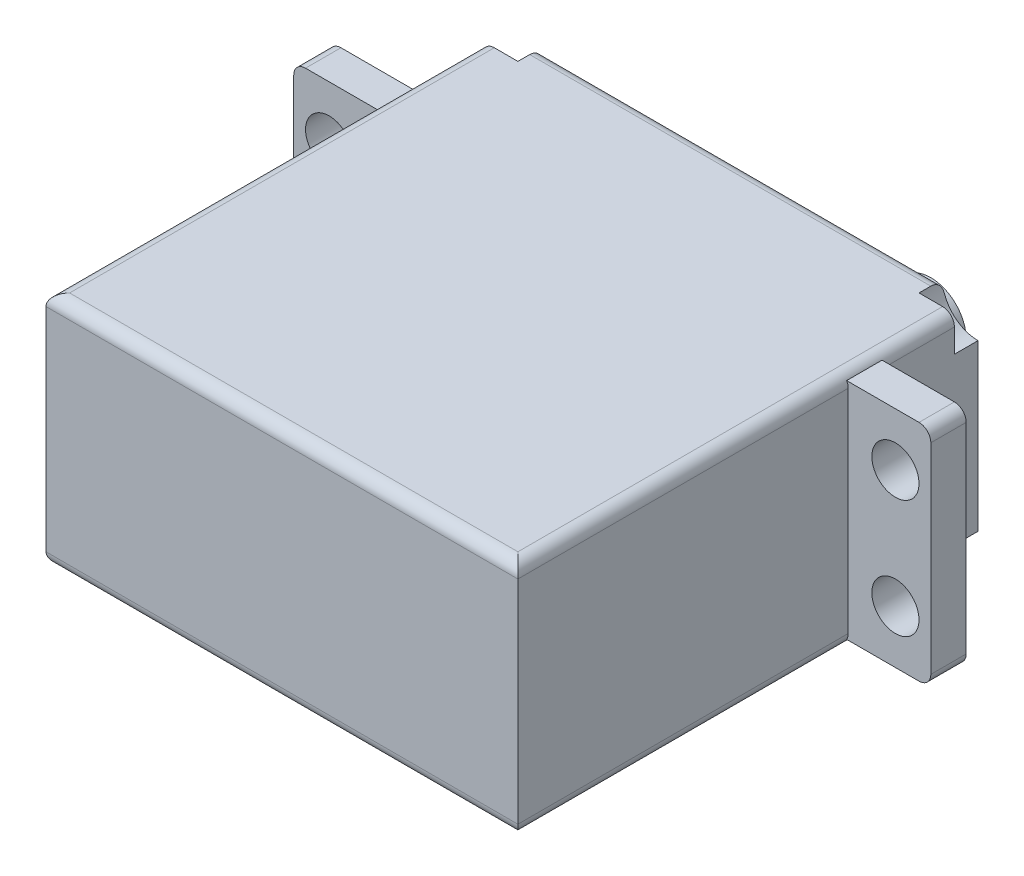
from build123d import *

# Parameters (mm, degrees)
SKETCH_1_W               = 40
SKETCH_1_H               = 39
EXTRUDE_1_DEPTH          = 20
SKETCH_6_R               = 5
EXTRUDE_3_DEPTH          = 1
SKETCH_7_R               = 4.5
EXTRUDE_4_DEPTH          = 0.5
SKETCH_8_R               = 4
EXTRUDE_5_DEPTH          = 0.5
SKETCH_9_R               = 3
EXTRUDE_6_DEPTH          = 4
SKETCH_11_W              = 3
SKETCH_11_H              = 20
EXTRUDE_7_DEPTH          = 7
SKETCH_12_R              = 2
CUT_EXTRUDE_2_DEPTH      = 7
SKETCH_13_W              = 3
SKETCH_13_H              = 20
EXTRUDE_8_DEPTH          = 7
SKETCH_14_R              = 2
CUT_EXTRUDE_3_DEPTH      = 7
SKETCH_15_R              = 3
CUT_EXTRUDE_4_DEPTH      = 2
CUT_EXTRUDE_6_DEPTH      = 65.265076052
CUT_EXTRUDE_6_DEPTH_BACK = 0.5
CUT_EXTRUDE_7_DEPTH      = 65.265076052
CUT_EXTRUDE_7_DEPTH_BACK = 0.5
CUT_EXTRUDE_8_DEPTH      = 65.265076052
CUT_EXTRUDE_8_DEPTH_BACK = 0.5
CUT_EXTRUDE_9_DEPTH      = 65.265076052
CUT_EXTRUDE_9_DEPTH_BACK = 0.5
FILLET_3_R               = 1


with BuildPart() as part:
    # 草图1 → 凸台-拉伸1 (new body)
    with BuildSketch(Plane(origin=(0, 0, 0), x_dir=(1, 0, 0), z_dir=(0, 1, 0))):
        with Locations((20, -19.5)):
            Rectangle(SKETCH_1_W, SKETCH_1_H)
    extrude(amount=EXTRUDE_1_DEPTH)

    # 草图6 → 凸台-拉伸3 (add)
    with BuildSketch(Plane(origin=(0, 0, 0), x_dir=(-1, 0, 0), z_dir=(0, 0, -1))):
        with Locations(Location((-30, 10.62304624, 0), (0, 0, 180))):
            Circle(SKETCH_6_R)
    extrude(amount=EXTRUDE_3_DEPTH)

    # 草图7 → 凸台-拉伸4 (add)
    with BuildSketch(Plane(origin=(0, 0, -1), x_dir=(-1, 0, 0), z_dir=(0, 0, -1))):
        with Locations((-30, 10.62304624)):
            Circle(SKETCH_7_R)
    extrude(amount=EXTRUDE_4_DEPTH)

    # 草图8 → 凸台-拉伸5 (add)
    with BuildSketch(Plane(origin=(0, 0, -1.5), x_dir=(-1, 0, 0), z_dir=(0, 0, -1))):
        with Locations((-30, 10.62304624)):
            Circle(SKETCH_8_R)
    extrude(amount=EXTRUDE_5_DEPTH)

    # 草图9 → 凸台-拉伸6 (add)
    with BuildSketch(Plane(origin=(0, 0, -2), x_dir=(-1, 0, 0), z_dir=(0, 0, -1))):
        with Locations((-30, 10.62304624)):
            Circle(SKETCH_9_R)
    extrude(amount=EXTRUDE_6_DEPTH)

    # 草图11 → 凸台-拉伸7 (add)
    with BuildSketch(Plane(origin=(40, 0, 0), x_dir=(0, 0, -1), z_dir=(1, 0, 0))):
        with Locations((-9.5, 10)):
            Rectangle(SKETCH_11_W, SKETCH_11_H)
    extrude(amount=EXTRUDE_7_DEPTH)

    # 草图12 → 切除-拉伸2 (cut)
    with BuildSketch(Plane(origin=(0, 0, 8), x_dir=(-1, 0, 0), z_dir=(0, 0, -1))):
        with Locations((-44, 15)):
            Circle(SKETCH_12_R)
        with Locations((-44, 5)):
            Circle(SKETCH_12_R)
    extrude(amount=-CUT_EXTRUDE_2_DEPTH, mode=Mode.SUBTRACT)

    # 草图13 → 凸台-拉伸8 (add)
    with BuildSketch(Plane.ZY):
        with Locations((9.5, 10)):
            Rectangle(SKETCH_13_W, SKETCH_13_H)
    extrude(amount=EXTRUDE_8_DEPTH)

    # 草图14 → 切除-拉伸3 (cut)
    with BuildSketch(Plane(origin=(0, 0, 8), x_dir=(-1, 0, 0), z_dir=(0, 0, -1))):
        with Locations(Location((4, 15, 0), (0, 0, 90))):
            Circle(SKETCH_14_R)
        with Locations(Location((4, 5, 0), (0, 0, 90))):
            Circle(SKETCH_14_R)
    extrude(amount=-CUT_EXTRUDE_3_DEPTH, mode=Mode.SUBTRACT)

    # 草图15 → 切除-拉伸4 (cut)
    with BuildSketch(Plane(origin=(0, 0, 0), x_dir=(-1, 0, 0), z_dir=(0, 0, -1))):
        with Locations((-40, 20)):
            Circle(SKETCH_15_R)
        with Locations((0, 20)):
            Circle(SKETCH_15_R)
        Circle(SKETCH_15_R)
        with Locations((-40, 0)):
            Circle(SKETCH_15_R)
    extrude(amount=-CUT_EXTRUDE_4_DEPTH, mode=Mode.SUBTRACT)

    # 草图16 → 切除-拉伸6 (cut, two sides: drawn at the far end of the back side and taken through both)
    with BuildSketch(Plane(origin=(0, 20, 0), x_dir=(1, 0, 0), z_dir=(0, 1, 0)).offset(-CUT_EXTRUDE_6_DEPTH_BACK)):
        Polygon((0, 114.605506082), (0, -8), (0, -11), (0, -133.605506082), (-245.211012164, -133.605506082), (-245.211012164, 114.605506082), align=None)
    extrude(amount=CUT_EXTRUDE_6_DEPTH + CUT_EXTRUDE_6_DEPTH_BACK, mode=Mode.SUBTRACT)

    # 草图17 → 切除-拉伸7 (cut, two sides: drawn at the far end of the back side and taken through both)
    with BuildSketch(Plane(origin=(0, 20, 0), x_dir=(1, 0, 0), z_dir=(0, 1, 0)).offset(-CUT_EXTRUDE_7_DEPTH_BACK)):
        Polygon((40, 114.605506082), (40, -8), (40, -11), (40, -133.605506082), (285.211012164, -133.605506082), (285.211012164, 114.605506082), align=None)
    extrude(amount=CUT_EXTRUDE_7_DEPTH + CUT_EXTRUDE_7_DEPTH_BACK, mode=Mode.SUBTRACT)

    # 草图19 → 切除-拉伸8 (cut, two sides: drawn at the far end of the back side and taken through both)
    with BuildSketch(Plane.XZ.offset(-CUT_EXTRUDE_8_DEPTH_BACK)):
        Polygon((0, 133.605506082), (0, 11), (0, 8), (0, -114.605506082), (-245.211012164, -114.605506082), (-245.211012164, 133.605506082), align=None)
    extrude(amount=CUT_EXTRUDE_8_DEPTH + CUT_EXTRUDE_8_DEPTH_BACK, mode=Mode.SUBTRACT)

    # 草图20 → 切除-拉伸9 (cut, two sides: drawn at the far end of the back side and taken through both)
    with BuildSketch(Plane.XZ.offset(-CUT_EXTRUDE_9_DEPTH_BACK)):
        Polygon((40, 133.605506082), (40, 11), (40, 8), (40, -114.605506082), (285.211012164, -114.605506082), (285.211012164, 133.605506082), align=None)
    extrude(amount=CUT_EXTRUDE_9_DEPTH + CUT_EXTRUDE_9_DEPTH_BACK, mode=Mode.SUBTRACT)

    # 圆角3
    # the kernel refuses this fillet: 1 mm, written as the material it takes off along each edge
    with BuildSketch(Plane(origin=(42.5, 0, 39), x_dir=(0, 1, 0), z_dir=(-1, 0, 0))) as fillet_3_piece_1:
        with BuildLine():
            CenterArc((FILLET_3_R, FILLET_3_R), FILLET_3_R, 180, 90)
            Line((0, FILLET_3_R), (0, 0))
            Line((0, 0), (FILLET_3_R, 0))
        make_face()
    extrude(amount=45, mode=Mode.SUBTRACT)
    with BuildSketch(Plane(origin=(42.5, 20, 39), x_dir=(0, -1, 0), z_dir=(-1, 0, 0))) as fillet_3_piece_2:
        with BuildLine():
            CenterArc((FILLET_3_R, -FILLET_3_R), FILLET_3_R, 90, 90)
            Line((0, -FILLET_3_R), (0, 0))
            Line((0, 0), (FILLET_3_R, 0))
        make_face()
    extrude(amount=45, mode=Mode.SUBTRACT)
    with BuildSketch(Plane(origin=(0, 0, 41.5), x_dir=(0, 1, 0), z_dir=(0, 0, -1))) as fillet_3_piece_3_section:
        with BuildLine():
            CenterArc((FILLET_3_R, FILLET_3_R), FILLET_3_R, 180, 90)
            Line((0, FILLET_3_R), (0, 0))
            Line((0, 0), (FILLET_3_R, 0))
        make_face()
    fillet_3_piece_3 = extrude(amount=42, mode=Mode.PRIVATE)
    fillet_3_piece_3 = split(fillet_3_piece_3, bisect_by=Plane(origin=(0.024008382, 0.663250785, 11), z_dir=(0, 0, 1)), keep=Keep.TOP, mode=Mode.PRIVATE)
    fillet_3_piece_3 = split(fillet_3_piece_3, bisect_by=Plane(origin=(0.024008382, 0.5, 26.25), z_dir=(0, 1, 0)), keep=Keep.TOP, mode=Mode.PRIVATE)
    add(fillet_3_piece_3, mode=Mode.SUBTRACT)
    with BuildSketch(Plane(origin=(0, 0, 41.5), x_dir=(0, 1, 0), z_dir=(0, 0, -1))) as fillet_3_piece_4_section:
        with BuildLine():
            CenterArc((FILLET_3_R, FILLET_3_R), FILLET_3_R, 180, 90)
            Line((0, FILLET_3_R), (0, 0))
            Line((0, 0), (FILLET_3_R, 0))
        make_face()
    fillet_3_piece_4 = extrude(amount=42, mode=Mode.PRIVATE)
    fillet_3_piece_4 = split(fillet_3_piece_4, bisect_by=Plane(origin=(0.25512006, 0.164391764, 11), z_dir=(0, 0, 1)), keep=Keep.TOP, mode=Mode.PRIVATE)
    fillet_3_piece_4 = split(fillet_3_piece_4, bisect_by=Plane(origin=(0.25512006, 0.5, 26.25), z_dir=(0, -1, 0)), keep=Keep.TOP, mode=Mode.PRIVATE)
    add(fillet_3_piece_4, mode=Mode.SUBTRACT)
    with BuildSketch(Plane(origin=(0, 0, 41.5), x_dir=(0, 1, 0), z_dir=(0, 0, -1))) as fillet_3_piece_5_section:
        with BuildLine():
            CenterArc((FILLET_3_R, FILLET_3_R), FILLET_3_R, 180, 90)
            Line((0, FILLET_3_R), (0, 0))
            Line((0, 0), (FILLET_3_R, 0))
        make_face()
    fillet_3_piece_5 = extrude(amount=42, mode=Mode.PRIVATE)
    fillet_3_piece_5 = split(fillet_3_piece_5, bisect_by=Plane(origin=(0.25512006, 0.164391764, 11), z_dir=(0, 0, -1)), keep=Keep.TOP, mode=Mode.PRIVATE)
    fillet_3_piece_5 = split(fillet_3_piece_5, bisect_by=Plane(origin=(0.25512006, 0.5, 9.5), z_dir=(0, -1, 0)), keep=Keep.TOP, mode=Mode.PRIVATE)
    fillet_3_piece_5 = split(fillet_3_piece_5, bisect_by=Plane(origin=(0.25512006, 0.164391764, 8), z_dir=(0, 0, 1)), keep=Keep.TOP, mode=Mode.PRIVATE)
    add(fillet_3_piece_5, mode=Mode.SUBTRACT)
    with BuildSketch(Plane(origin=(0, 0, 41.5), x_dir=(0, 1, 0), z_dir=(0, 0, -1))) as fillet_3_piece_6_section:
        with BuildLine():
            CenterArc((FILLET_3_R, FILLET_3_R), FILLET_3_R, 180, 90)
            Line((0, FILLET_3_R), (0, 0))
            Line((0, 0), (FILLET_3_R, 0))
        make_face()
    fillet_3_piece_6 = extrude(amount=42, mode=Mode.PRIVATE)
    fillet_3_piece_6 = split(fillet_3_piece_6, bisect_by=Plane(origin=(0.024008382, 0.5, 3.75), z_dir=(0, 1, 0)), keep=Keep.TOP, mode=Mode.PRIVATE)
    fillet_3_piece_6 = split(fillet_3_piece_6, bisect_by=Plane(origin=(0.024008382, 0.663250785, 8), z_dir=(0, 0, -1)), keep=Keep.TOP, mode=Mode.PRIVATE)
    add(fillet_3_piece_6, mode=Mode.SUBTRACT)
    with BuildSketch(Plane(origin=(0, 0, 41.5), x_dir=(0, 1, 0), z_dir=(0, 0, -1))) as fillet_3_piece_7_section:
        with BuildLine():
            CenterArc((FILLET_3_R, FILLET_3_R), FILLET_3_R, 180, 90)
            Line((0, FILLET_3_R), (0, 0))
            Line((0, 0), (FILLET_3_R, 0))
        make_face()
    fillet_3_piece_7 = extrude(amount=42, mode=Mode.PRIVATE)
    fillet_3_piece_7 = split(fillet_3_piece_7, bisect_by=Plane(origin=(0.25512006, 0.5, 3.75), z_dir=(0, -1, 0)), keep=Keep.TOP, mode=Mode.PRIVATE)
    fillet_3_piece_7 = split(fillet_3_piece_7, bisect_by=Plane(origin=(0.25512006, 0.164391764, 8), z_dir=(0, 0, -1)), keep=Keep.TOP, mode=Mode.PRIVATE)
    add(fillet_3_piece_7, mode=Mode.SUBTRACT)
    with BuildSketch(Plane(origin=(-7, 0.5, 5.5), x_dir=(0, 1, 0), z_dir=(0, 0, 1)), Plane(origin=(47, 19.5, 13.5), x_dir=(-1, 0, 0), z_dir=(0, 0, -1))) as fillet_3_piece_8:
        with BuildLine():
            CenterArc((FILLET_3_R, -FILLET_3_R), FILLET_3_R, 90, 90)
            Line((0, -FILLET_3_R), (0, 0))
            Line((0, 0), (FILLET_3_R, 0))
        make_face()
    extrude(amount=8, mode=Mode.SUBTRACT)
    with BuildSketch(Plane(origin=(0.5, 0, 0), x_dir=(0, 1, 0), z_dir=(1, 0, 0))) as fillet_3_piece_9:
        with BuildLine():
            CenterArc((FILLET_3_R, FILLET_3_R), FILLET_3_R, 180, 90)
            Line((0, FILLET_3_R), (0, 0))
            Line((0, 0), (FILLET_3_R, 0))
        make_face()
    extrude(amount=39, mode=Mode.SUBTRACT)
    with BuildSketch(Plane(origin=(47, 0.5, 5.5), x_dir=(0, 1, 0), z_dir=(0, 0, 1)), Plane(origin=(-7, 19.5, 13.5), x_dir=(1, 0, 0), z_dir=(0, 0, -1))) as fillet_3_piece_10:
        with BuildLine():
            CenterArc((FILLET_3_R, FILLET_3_R), FILLET_3_R, 180, 90)
            Line((0, FILLET_3_R), (0, 0))
            Line((0, 0), (FILLET_3_R, 0))
        make_face()
    extrude(amount=8, mode=Mode.SUBTRACT)
    with BuildSketch(Plane(origin=(40, 0, -0.5), x_dir=(0, 1, 0), z_dir=(0, 0, 1))) as fillet_3_piece_11_section:
        with BuildLine():
            CenterArc((FILLET_3_R, FILLET_3_R), FILLET_3_R, 180, 90)
            Line((0, FILLET_3_R), (0, 0))
            Line((0, 0), (FILLET_3_R, 0))
        make_face()
    fillet_3_piece_11 = extrude(amount=42, mode=Mode.PRIVATE)
    fillet_3_piece_11 = split(fillet_3_piece_11, bisect_by=Plane(origin=(39.975991618, 0.663250785, 8), z_dir=(0, 0, -1)), keep=Keep.TOP, mode=Mode.PRIVATE)
    fillet_3_piece_11 = split(fillet_3_piece_11, bisect_by=Plane(origin=(39.975991618, 0.5, 3.75), z_dir=(0, 1, 0)), keep=Keep.TOP, mode=Mode.PRIVATE)
    add(fillet_3_piece_11, mode=Mode.SUBTRACT)
    with BuildSketch(Plane(origin=(40, 0, -0.5), x_dir=(0, 1, 0), z_dir=(0, 0, 1))) as fillet_3_piece_12_section:
        with BuildLine():
            CenterArc((FILLET_3_R, FILLET_3_R), FILLET_3_R, 180, 90)
            Line((0, FILLET_3_R), (0, 0))
            Line((0, 0), (FILLET_3_R, 0))
        make_face()
    fillet_3_piece_12 = extrude(amount=42, mode=Mode.PRIVATE)
    fillet_3_piece_12 = split(fillet_3_piece_12, bisect_by=Plane(origin=(39.74487994, 0.164391764, 8), z_dir=(0, 0, -1)), keep=Keep.TOP, mode=Mode.PRIVATE)
    fillet_3_piece_12 = split(fillet_3_piece_12, bisect_by=Plane(origin=(39.74487994, 0.5, 3.75), z_dir=(0, -1, 0)), keep=Keep.TOP, mode=Mode.PRIVATE)
    add(fillet_3_piece_12, mode=Mode.SUBTRACT)
    with BuildSketch(Plane(origin=(40, 0, -0.5), x_dir=(0, 1, 0), z_dir=(0, 0, 1))) as fillet_3_piece_13_section:
        with BuildLine():
            CenterArc((FILLET_3_R, FILLET_3_R), FILLET_3_R, 180, 90)
            Line((0, FILLET_3_R), (0, 0))
            Line((0, 0), (FILLET_3_R, 0))
        make_face()
    fillet_3_piece_13 = extrude(amount=42, mode=Mode.PRIVATE)
    fillet_3_piece_13 = split(fillet_3_piece_13, bisect_by=Plane(origin=(39.74487994, 0.164391764, 8), z_dir=(0, 0, 1)), keep=Keep.TOP, mode=Mode.PRIVATE)
    fillet_3_piece_13 = split(fillet_3_piece_13, bisect_by=Plane(origin=(39.74487994, 0.5, 9.5), z_dir=(0, -1, 0)), keep=Keep.TOP, mode=Mode.PRIVATE)
    fillet_3_piece_13 = split(fillet_3_piece_13, bisect_by=Plane(origin=(39.74487994, 0.164391764, 11), z_dir=(0, 0, -1)), keep=Keep.TOP, mode=Mode.PRIVATE)
    add(fillet_3_piece_13, mode=Mode.SUBTRACT)
    with BuildSketch(Plane(origin=(40, 0, -0.5), x_dir=(0, 1, 0), z_dir=(0, 0, 1))) as fillet_3_piece_14_section:
        with BuildLine():
            CenterArc((FILLET_3_R, FILLET_3_R), FILLET_3_R, 180, 90)
            Line((0, FILLET_3_R), (0, 0))
            Line((0, 0), (FILLET_3_R, 0))
        make_face()
    fillet_3_piece_14 = extrude(amount=42, mode=Mode.PRIVATE)
    fillet_3_piece_14 = split(fillet_3_piece_14, bisect_by=Plane(origin=(39.975991618, 0.5, 26.25), z_dir=(0, 1, 0)), keep=Keep.TOP, mode=Mode.PRIVATE)
    fillet_3_piece_14 = split(fillet_3_piece_14, bisect_by=Plane(origin=(39.975991618, 0.663250785, 11), z_dir=(0, 0, 1)), keep=Keep.TOP, mode=Mode.PRIVATE)
    add(fillet_3_piece_14, mode=Mode.SUBTRACT)
    with BuildSketch(Plane(origin=(40, 0, -0.5), x_dir=(0, 1, 0), z_dir=(0, 0, 1))) as fillet_3_piece_15_section:
        with BuildLine():
            CenterArc((FILLET_3_R, FILLET_3_R), FILLET_3_R, 180, 90)
            Line((0, FILLET_3_R), (0, 0))
            Line((0, 0), (FILLET_3_R, 0))
        make_face()
    fillet_3_piece_15 = extrude(amount=42, mode=Mode.PRIVATE)
    fillet_3_piece_15 = split(fillet_3_piece_15, bisect_by=Plane(origin=(39.74487994, 0.5, 26.25), z_dir=(0, -1, 0)), keep=Keep.TOP, mode=Mode.PRIVATE)
    fillet_3_piece_15 = split(fillet_3_piece_15, bisect_by=Plane(origin=(39.74487994, 0.164391764, 11), z_dir=(0, 0, 1)), keep=Keep.TOP, mode=Mode.PRIVATE)
    add(fillet_3_piece_15, mode=Mode.SUBTRACT)
    with BuildSketch(Plane(origin=(40, 20, -0.5), x_dir=(-1, 0, 0), z_dir=(0, 0, 1))) as fillet_3_piece_16_section:
        with BuildLine():
            CenterArc((FILLET_3_R, FILLET_3_R), FILLET_3_R, 180, 90)
            Line((0, FILLET_3_R), (0, 0))
            Line((0, 0), (FILLET_3_R, 0))
        make_face()
    fillet_3_piece_16 = extrude(amount=42, mode=Mode.PRIVATE)
    fillet_3_piece_16 = split(fillet_3_piece_16, bisect_by=Plane(origin=(39.74487994, 19.835608236, 8), z_dir=(0, 0, -1)), keep=Keep.TOP, mode=Mode.PRIVATE)
    fillet_3_piece_16 = split(fillet_3_piece_16, bisect_by=Plane(origin=(39.74487994, 19.5, 3.75), z_dir=(0, 1, 0)), keep=Keep.TOP, mode=Mode.PRIVATE)
    add(fillet_3_piece_16, mode=Mode.SUBTRACT)
    with BuildSketch(Plane(origin=(40, 20, -0.5), x_dir=(-1, 0, 0), z_dir=(0, 0, 1))) as fillet_3_piece_17_section:
        with BuildLine():
            CenterArc((FILLET_3_R, FILLET_3_R), FILLET_3_R, 180, 90)
            Line((0, FILLET_3_R), (0, 0))
            Line((0, 0), (FILLET_3_R, 0))
        make_face()
    fillet_3_piece_17 = extrude(amount=42, mode=Mode.PRIVATE)
    fillet_3_piece_17 = split(fillet_3_piece_17, bisect_by=Plane(origin=(39.975991618, 19.336749215, 8), z_dir=(0, 0, -1)), keep=Keep.TOP, mode=Mode.PRIVATE)
    fillet_3_piece_17 = split(fillet_3_piece_17, bisect_by=Plane(origin=(39.975991618, 19.5, 3.75), z_dir=(0, -1, 0)), keep=Keep.TOP, mode=Mode.PRIVATE)
    add(fillet_3_piece_17, mode=Mode.SUBTRACT)
    with BuildSketch(Plane(origin=(40, 20, -0.5), x_dir=(-1, 0, 0), z_dir=(0, 0, 1))) as fillet_3_piece_18_section:
        with BuildLine():
            CenterArc((FILLET_3_R, FILLET_3_R), FILLET_3_R, 180, 90)
            Line((0, FILLET_3_R), (0, 0))
            Line((0, 0), (FILLET_3_R, 0))
        make_face()
    fillet_3_piece_18 = extrude(amount=42, mode=Mode.PRIVATE)
    fillet_3_piece_18 = split(fillet_3_piece_18, bisect_by=Plane(origin=(39.74487994, 19.835608236, 8), z_dir=(0, 0, 1)), keep=Keep.TOP, mode=Mode.PRIVATE)
    fillet_3_piece_18 = split(fillet_3_piece_18, bisect_by=Plane(origin=(39.74487994, 19.835608236, 11), z_dir=(0, 0, -1)), keep=Keep.TOP, mode=Mode.PRIVATE)
    fillet_3_piece_18 = split(fillet_3_piece_18, bisect_by=Plane(origin=(39.74487994, 19.5, 9.5), z_dir=(0, 1, 0)), keep=Keep.TOP, mode=Mode.PRIVATE)
    add(fillet_3_piece_18, mode=Mode.SUBTRACT)
    with BuildSketch(Plane(origin=(40, 20, -0.5), x_dir=(-1, 0, 0), z_dir=(0, 0, 1))) as fillet_3_piece_19_section:
        with BuildLine():
            CenterArc((FILLET_3_R, FILLET_3_R), FILLET_3_R, 180, 90)
            Line((0, FILLET_3_R), (0, 0))
            Line((0, 0), (FILLET_3_R, 0))
        make_face()
    fillet_3_piece_19 = extrude(amount=42, mode=Mode.PRIVATE)
    fillet_3_piece_19 = split(fillet_3_piece_19, bisect_by=Plane(origin=(39.74487994, 19.835608236, 11), z_dir=(0, 0, 1)), keep=Keep.TOP, mode=Mode.PRIVATE)
    fillet_3_piece_19 = split(fillet_3_piece_19, bisect_by=Plane(origin=(39.74487994, 19.5, 26.25), z_dir=(0, 1, 0)), keep=Keep.TOP, mode=Mode.PRIVATE)
    add(fillet_3_piece_19, mode=Mode.SUBTRACT)
    with BuildSketch(Plane(origin=(40, 20, -0.5), x_dir=(-1, 0, 0), z_dir=(0, 0, 1))) as fillet_3_piece_20_section:
        with BuildLine():
            CenterArc((FILLET_3_R, FILLET_3_R), FILLET_3_R, 180, 90)
            Line((0, FILLET_3_R), (0, 0))
            Line((0, 0), (FILLET_3_R, 0))
        make_face()
    fillet_3_piece_20 = extrude(amount=42, mode=Mode.PRIVATE)
    fillet_3_piece_20 = split(fillet_3_piece_20, bisect_by=Plane(origin=(39.975991618, 19.336749215, 11), z_dir=(0, 0, 1)), keep=Keep.TOP, mode=Mode.PRIVATE)
    fillet_3_piece_20 = split(fillet_3_piece_20, bisect_by=Plane(origin=(39.975991618, 19.5, 26.25), z_dir=(0, -1, 0)), keep=Keep.TOP, mode=Mode.PRIVATE)
    add(fillet_3_piece_20, mode=Mode.SUBTRACT)
    with BuildSketch(Plane(origin=(0.5, 20, 0), x_dir=(0, -1, 0), z_dir=(1, 0, 0))) as fillet_3_piece_21:
        with BuildLine():
            CenterArc((FILLET_3_R, -FILLET_3_R), FILLET_3_R, 90, 90)
            Line((0, -FILLET_3_R), (0, 0))
            Line((0, 0), (FILLET_3_R, 0))
        make_face()
    extrude(amount=39, mode=Mode.SUBTRACT)
    with BuildSketch(Plane(origin=(0, 20, -0.5), x_dir=(0, -1, 0), z_dir=(0, 0, 1))) as fillet_3_piece_22_section:
        with BuildLine():
            CenterArc((FILLET_3_R, FILLET_3_R), FILLET_3_R, 180, 90)
            Line((0, FILLET_3_R), (0, 0))
            Line((0, 0), (FILLET_3_R, 0))
        make_face()
    fillet_3_piece_22 = extrude(amount=42, mode=Mode.PRIVATE)
    fillet_3_piece_22 = split(fillet_3_piece_22, bisect_by=Plane(origin=(0.024008382, 19.336749215, 8), z_dir=(0, 0, -1)), keep=Keep.TOP, mode=Mode.PRIVATE)
    fillet_3_piece_22 = split(fillet_3_piece_22, bisect_by=Plane(origin=(0.024008382, 19.5, 3.75), z_dir=(0, -1, 0)), keep=Keep.TOP, mode=Mode.PRIVATE)
    add(fillet_3_piece_22, mode=Mode.SUBTRACT)
    with BuildSketch(Plane(origin=(0, 20, -0.5), x_dir=(0, -1, 0), z_dir=(0, 0, 1))) as fillet_3_piece_23_section:
        with BuildLine():
            CenterArc((FILLET_3_R, FILLET_3_R), FILLET_3_R, 180, 90)
            Line((0, FILLET_3_R), (0, 0))
            Line((0, 0), (FILLET_3_R, 0))
        make_face()
    fillet_3_piece_23 = extrude(amount=42, mode=Mode.PRIVATE)
    fillet_3_piece_23 = split(fillet_3_piece_23, bisect_by=Plane(origin=(0.25512006, 19.835608236, 8), z_dir=(0, 0, -1)), keep=Keep.TOP, mode=Mode.PRIVATE)
    fillet_3_piece_23 = split(fillet_3_piece_23, bisect_by=Plane(origin=(0.25512006, 19.5, 3.75), z_dir=(0, 1, 0)), keep=Keep.TOP, mode=Mode.PRIVATE)
    add(fillet_3_piece_23, mode=Mode.SUBTRACT)
    with BuildSketch(Plane(origin=(0, 20, -0.5), x_dir=(0, -1, 0), z_dir=(0, 0, 1))) as fillet_3_piece_24_section:
        with BuildLine():
            CenterArc((FILLET_3_R, FILLET_3_R), FILLET_3_R, 180, 90)
            Line((0, FILLET_3_R), (0, 0))
            Line((0, 0), (FILLET_3_R, 0))
        make_face()
    fillet_3_piece_24 = extrude(amount=42, mode=Mode.PRIVATE)
    fillet_3_piece_24 = split(fillet_3_piece_24, bisect_by=Plane(origin=(0.25512006, 19.835608236, 11), z_dir=(0, 0, -1)), keep=Keep.TOP, mode=Mode.PRIVATE)
    fillet_3_piece_24 = split(fillet_3_piece_24, bisect_by=Plane(origin=(0.25512006, 19.835608236, 8), z_dir=(0, 0, 1)), keep=Keep.TOP, mode=Mode.PRIVATE)
    fillet_3_piece_24 = split(fillet_3_piece_24, bisect_by=Plane(origin=(0.25512006, 19.5, 9.5), z_dir=(0, 1, 0)), keep=Keep.TOP, mode=Mode.PRIVATE)
    add(fillet_3_piece_24, mode=Mode.SUBTRACT)
    with BuildSketch(Plane(origin=(0, 20, -0.5), x_dir=(0, -1, 0), z_dir=(0, 0, 1))) as fillet_3_piece_25_section:
        with BuildLine():
            CenterArc((FILLET_3_R, FILLET_3_R), FILLET_3_R, 180, 90)
            Line((0, FILLET_3_R), (0, 0))
            Line((0, 0), (FILLET_3_R, 0))
        make_face()
    fillet_3_piece_25 = extrude(amount=42, mode=Mode.PRIVATE)
    fillet_3_piece_25 = split(fillet_3_piece_25, bisect_by=Plane(origin=(0.024008382, 19.336749215, 11), z_dir=(0, 0, 1)), keep=Keep.TOP, mode=Mode.PRIVATE)
    fillet_3_piece_25 = split(fillet_3_piece_25, bisect_by=Plane(origin=(0.024008382, 19.5, 26.25), z_dir=(0, -1, 0)), keep=Keep.TOP, mode=Mode.PRIVATE)
    add(fillet_3_piece_25, mode=Mode.SUBTRACT)
    with BuildSketch(Plane(origin=(0, 20, -0.5), x_dir=(0, -1, 0), z_dir=(0, 0, 1))) as fillet_3_piece_26_section:
        with BuildLine():
            CenterArc((FILLET_3_R, FILLET_3_R), FILLET_3_R, 180, 90)
            Line((0, FILLET_3_R), (0, 0))
            Line((0, 0), (FILLET_3_R, 0))
        make_face()
    fillet_3_piece_26 = extrude(amount=42, mode=Mode.PRIVATE)
    fillet_3_piece_26 = split(fillet_3_piece_26, bisect_by=Plane(origin=(0.25512006, 19.835608236, 11), z_dir=(0, 0, 1)), keep=Keep.TOP, mode=Mode.PRIVATE)
    fillet_3_piece_26 = split(fillet_3_piece_26, bisect_by=Plane(origin=(0.25512006, 19.5, 26.25), z_dir=(0, 1, 0)), keep=Keep.TOP, mode=Mode.PRIVATE)
    add(fillet_3_piece_26, mode=Mode.SUBTRACT)


solid = part.part
